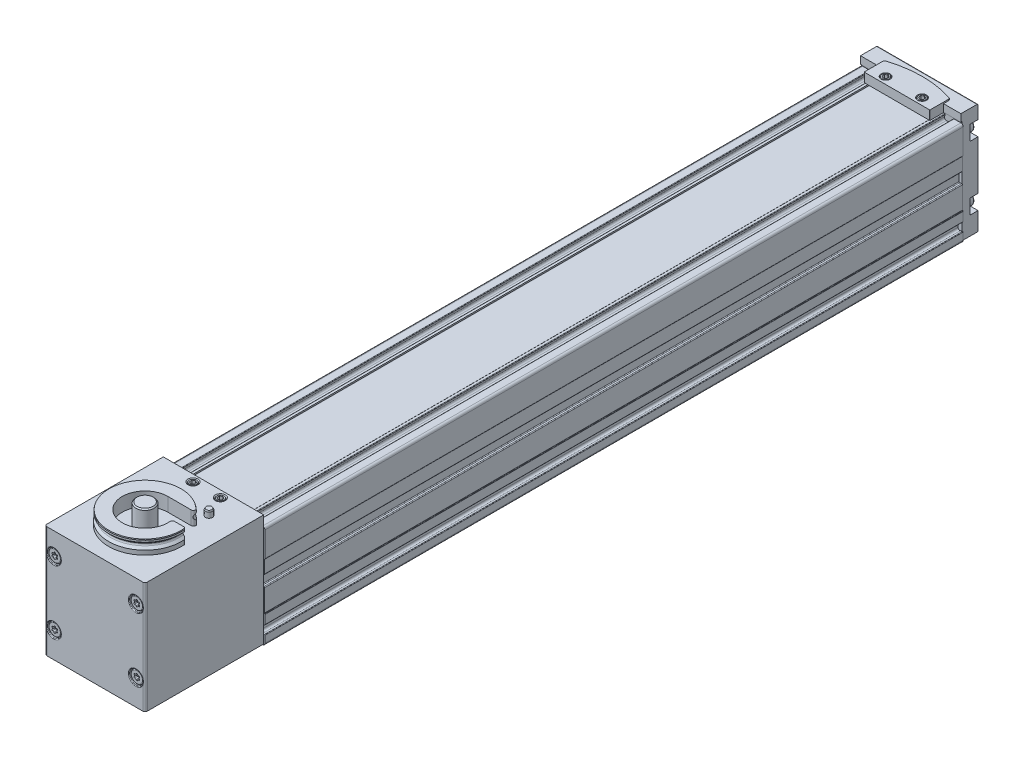
from build123d import *

# Parameters (mm, degrees)
BOSS_EXTRUDE1_DEPTH      = 49
BOSS_EXTRUDE2_DEPTH      = 306
SKETCH3_W                = 65
SKETCH3_H                = 55
CUT_EXTRUDE1_DEPTH       = 306
SKETCH4_W                = 65
SKETCH4_H                = 55
CUT_EXTRUDE2_DEPTH       = 266.5
SKETCH5_W                = 26
SKETCH5_H                = 0.1
BOSS_EXTRUDE3_DEPTH      = 306
BOSS_EXTRUDE4_DEPTH      = 6
LPATTERN1_COUNT          = 2
LPATTERN1_PITCH          = 28
LPATTERN2_COUNT          = 2
LPATTERN2_PITCH          = 28
CUT_EXTRUDE3_DEPTH       = 1.67
LPATTERN3_COUNT          = 2
LPATTERN3_PITCH          = 36
LPATTERN3_COUNT_DIR2     = 2
LPATTERN3_PITCH_DIR2     = 28
BOSS_EXTRUDE5_DEPTH      = 22
BOSS_EXTRUDE5_DEPTH_BACK = 22
BOSS_EXTRUDE6_DEPTH      = 4
CUT_EXTRUDE4_DEPTH       = 3.4
LPATTERN4_COUNT          = 2
LPATTERN4_PITCH          = 28
CUT_EXTRUDE5_DEPTH       = 3.4
LPATTERN5_COUNT          = 2
LPATTERN5_PITCH          = 28
LPATTERN6_COUNT          = 2
LPATTERN6_PITCH          = 28
LPATTERN7_COUNT          = 2
LPATTERN7_PITCH          = 28
CUT_EXTRUDE6_START       = 1.67
CUT_EXTRUDE6_DEPTH       = 1.67
LPATTERN8_COUNT          = 2
LPATTERN8_PITCH          = 36
LPATTERN8_COUNT_DIR2     = 2
LPATTERN8_PITCH_DIR2     = 28
CUT_EXTRUDE7_DEPTH       = 2.43
LPATTERN9_COUNT          = 2
LPATTERN9_PITCH          = 12
CUT_EXTRUDE8_DEPTH       = 2.1
LPATTERN10_COUNT         = 2
LPATTERN10_PITCH         = 12
LPATTERN11_COUNT         = 2
LPATTERN11_PITCH         = 16
LPATTERN12_COUNT         = 2
LPATTERN12_PITCH         = 16
CUT_EXTRUDE9_DEPTH       = 2.84
LPATTERN13_COUNT         = 2
LPATTERN13_PITCH         = 16
CUT_EXTRUDE10_DEPTH      = 2.5
LPATTERN14_COUNT         = 2
LPATTERN14_PITCH         = 32.984845005


with BuildPart() as part:
    # Sketch1 → Boss-Extrude1 (new body)
    with BuildSketch(Plane(origin=(0, 0, 0), x_dir=(1, 0, 0), z_dir=(0, 1, 0))):
        with BuildLine():
            Line((-21, -52), (21, -52))
            ThreePointArc((21, -52), (21.707106781, -51.707106781), (22, -51))
            Line((22, -51), (22, 0))
            Line((22, 0), (-22, 0))
            Line((-22, 0), (-22, -51))
            ThreePointArc((-22, -51), (-21.707106781, -51.707106781), (-21, -52))
        make_face()
    extrude(amount=BOSS_EXTRUDE1_DEPTH)

    # Sketch2 → Boss-Extrude2 (add)
    with BuildSketch(Plane.XY):
        Polygon((-22.5, -0.5), (22.5, -0.5), (22.5, 44.5), (13.4, 44.5), (13.4, 43.9), (-13.4, 43.9), (-13.4, 44.5), (-22.5, 44.5), align=None)
    extrude(amount=-BOSS_EXTRUDE2_DEPTH)

    # Sketch3 → Cut-Extrude1 (cut)
    with BuildSketch(Plane.XY):
        with Locations((0, 22)):
            Rectangle(SKETCH3_W, SKETCH3_H)
        with BuildLine():
            Line((-21.5, -0.5), (-18.460645075, -0.5))
            ThreePointArc((-18.460645075, -0.5), (-18.301974407, -0.421752286), (-18.267459909, -0.248236191))
            Line((-18.267459909, -0.248236191), (-18.546443505, 0.792944764))
            ThreePointArc((-18.546443505, 0.792944764), (-18.408385517, 1.487009143), (-17.773702844, 1.8))
            Line((-17.773702844, 1.8), (-15.126297156, 1.8))
            ThreePointArc((-15.126297156, 1.8), (-14.491614483, 1.487009143), (-14.353556495, 0.792944764))
            Line((-14.353556495, 0.792944764), (-14.632540091, -0.248236191))
            ThreePointArc((-14.632540091, -0.248236191), (-14.598025593, -0.421752286), (-14.439354925, -0.5))
            Line((-14.439354925, -0.5), (-7.582842712, -0.5))
            ThreePointArc((-7.582842712, -0.5), (-7.506306026, -0.484775907), (-7.441421356, -0.441421356))
            Line((-7.441421356, -0.441421356), (-7.308578644, -0.308578644))
            ThreePointArc((-7.308578644, -0.308578644), (-7.243693974, -0.265224093), (-7.167157288, -0.25))
            Line((-7.167157288, -0.25), (-4.832842712, -0.25))
            ThreePointArc((-4.832842712, -0.25), (-4.756306026, -0.265224093), (-4.691421356, -0.308578644))
            Line((-4.691421356, -0.308578644), (-4.558578644, -0.441421356))
            ThreePointArc((-4.558578644, -0.441421356), (-4.493693974, -0.484775907), (-4.417157288, -0.5))
            Line((-4.417157288, -0.5), (4.417157288, -0.5))
            ThreePointArc((4.417157288, -0.5), (4.493693974, -0.484775907), (4.558578644, -0.441421356))
            Line((4.558578644, -0.441421356), (4.691421356, -0.308578644))
            ThreePointArc((4.691421356, -0.308578644), (4.756306026, -0.265224093), (4.832842712, -0.25))
            Line((4.832842712, -0.25), (7.167157288, -0.25))
            ThreePointArc((7.167157288, -0.25), (7.243693974, -0.265224093), (7.308578644, -0.308578644))
            Line((7.308578644, -0.308578644), (7.441421356, -0.441421356))
            ThreePointArc((7.441421356, -0.441421356), (7.506306026, -0.484775907), (7.582842712, -0.5))
            Line((7.582842712, -0.5), (14.439354925, -0.5))
            ThreePointArc((14.439354925, -0.5), (14.598025593, -0.421752286), (14.632540091, -0.248236191))
            Line((14.632540091, -0.248236191), (14.353556495, 0.792944764))
            ThreePointArc((14.353556495, 0.792944764), (14.491614483, 1.487009143), (15.126297156, 1.8))
            Line((15.126297156, 1.8), (17.773702844, 1.8))
            ThreePointArc((17.773702844, 1.8), (18.408385517, 1.487009143), (18.546443505, 0.792944764))
            Line((18.546443505, 0.792944764), (18.267459909, -0.248236191))
            ThreePointArc((18.267459909, -0.248236191), (18.301974407, -0.421752286), (18.460645075, -0.5))
            Line((18.460645075, -0.5), (21.5, -0.5))
            ThreePointArc((21.5, -0.5), (22.207106781, -0.207106781), (22.5, 0.5))
            Line((22.5, 0.5), (22.5, 3.539354925))
            ThreePointArc((22.5, 3.539354925), (22.421752286, 3.698025593), (22.248236191, 3.732540091))
            Line((22.248236191, 3.732540091), (21.207055236, 3.453556495))
            ThreePointArc((21.207055236, 3.453556495), (20.512990857, 3.591614483), (20.2, 4.226297156))
            Line((20.2, 4.226297156), (20.2, 6.873702844))
            ThreePointArc((20.2, 6.873702844), (20.512990857, 7.508385517), (21.207055236, 7.646443505))
            Line((21.207055236, 7.646443505), (22.248236191, 7.367459909))
            ThreePointArc((22.248236191, 7.367459909), (22.421752286, 7.401974407), (22.5, 7.560645075))
            Line((22.5, 7.560645075), (22.5, 11.417157288))
            ThreePointArc((22.5, 11.417157288), (22.484775907, 11.493693974), (22.441421356, 11.558578644))
            Line((22.441421356, 11.558578644), (22.308578644, 11.691421356))
            ThreePointArc((22.308578644, 11.691421356), (22.265224093, 11.756306026), (22.25, 11.832842712))
            Line((22.25, 11.832842712), (22.25, 21.392473922))
            ThreePointArc((22.25, 21.392473922), (22.142836283, 21.622287255), (21.897905547, 21.687916248))
            Line((21.897905547, 21.687916248), (21.002094453, 21.529960583))
            ThreePointArc((21.002094453, 21.529960583), (20.757163717, 21.595589576), (20.65, 21.825402909))
            Line((20.65, 21.825402909), (20.65, 26.174597091))
            ThreePointArc((20.65, 26.174597091), (20.757163717, 26.404410424), (21.002094453, 26.470039417))
            Line((21.002094453, 26.470039417), (21.897905547, 26.312083752))
            ThreePointArc((21.897905547, 26.312083752), (22.142836283, 26.377712745), (22.25, 26.607526078))
            Line((22.25, 26.607526078), (22.25, 32.167157288))
            ThreePointArc((22.25, 32.167157288), (22.265224093, 32.243693974), (22.308578644, 32.308578644))
            Line((22.308578644, 32.308578644), (22.441421356, 32.441421356))
            ThreePointArc((22.441421356, 32.441421356), (22.484775907, 32.506306026), (22.5, 32.582842712))
            Line((22.5, 32.582842712), (22.5, 43.5))
            ThreePointArc((22.5, 43.5), (22.207106781, 44.207106781), (21.5, 44.5))
            Line((21.5, 44.5), (18.460645075, 44.5))
            ThreePointArc((18.460645075, 44.5), (18.301974407, 44.421752286), (18.267459909, 44.248236191))
            Line((18.267459909, 44.248236191), (18.546443505, 43.207055236))
            ThreePointArc((18.546443505, 43.207055236), (18.408385517, 42.512990857), (17.773702844, 42.2))
            Line((17.773702844, 42.2), (15.126297156, 42.2))
            ThreePointArc((15.126297156, 42.2), (14.491614483, 42.512990857), (14.353556495, 43.207055236))
            Line((14.353556495, 43.207055236), (14.632540091, 44.248236191))
            ThreePointArc((14.632540091, 44.248236191), (14.598025593, 44.421752286), (14.439354925, 44.5))
            Line((14.439354925, 44.5), (-14.439354925, 44.5))
            ThreePointArc((-14.439354925, 44.5), (-14.598025593, 44.421752286), (-14.632540091, 44.248236191))
            Line((-14.632540091, 44.248236191), (-14.353556495, 43.207055236))
            ThreePointArc((-14.353556495, 43.207055236), (-14.491614483, 42.512990857), (-15.126297156, 42.2))
            Line((-15.126297156, 42.2), (-17.773702844, 42.2))
            ThreePointArc((-17.773702844, 42.2), (-18.408385517, 42.512990857), (-18.546443505, 43.207055236))
            Line((-18.546443505, 43.207055236), (-18.267459909, 44.248236191))
            ThreePointArc((-18.267459909, 44.248236191), (-18.301974407, 44.421752286), (-18.460645075, 44.5))
            Line((-18.460645075, 44.5), (-21.5, 44.5))
            ThreePointArc((-21.5, 44.5), (-22.207106781, 44.207106781), (-22.5, 43.5))
            Line((-22.5, 43.5), (-22.5, 32.582842712))
            ThreePointArc((-22.5, 32.582842712), (-22.484775907, 32.506306026), (-22.441421356, 32.441421356))
            Line((-22.441421356, 32.441421356), (-22.308578644, 32.308578644))
            ThreePointArc((-22.308578644, 32.308578644), (-22.265224093, 32.243693974), (-22.25, 32.167157288))
            Line((-22.25, 32.167157288), (-22.25, 26.607526078))
            ThreePointArc((-22.25, 26.607526078), (-22.142836283, 26.377712745), (-21.897905547, 26.312083752))
            Line((-21.897905547, 26.312083752), (-21.002094453, 26.470039417))
            ThreePointArc((-21.002094453, 26.470039417), (-20.757163717, 26.404410424), (-20.65, 26.174597091))
            Line((-20.65, 26.174597091), (-20.65, 21.825402909))
            ThreePointArc((-20.65, 21.825402909), (-20.757163717, 21.595589576), (-21.002094453, 21.529960583))
            Line((-21.002094453, 21.529960583), (-21.897905547, 21.687916248))
            ThreePointArc((-21.897905547, 21.687916248), (-22.142836283, 21.622287255), (-22.25, 21.392473922))
            Line((-22.25, 21.392473922), (-22.25, 11.832842712))
            ThreePointArc((-22.25, 11.832842712), (-22.265224093, 11.756306026), (-22.308578644, 11.691421356))
            Line((-22.308578644, 11.691421356), (-22.441421356, 11.558578644))
            ThreePointArc((-22.441421356, 11.558578644), (-22.484775907, 11.493693974), (-22.5, 11.417157288))
            Line((-22.5, 11.417157288), (-22.5, 7.560645075))
            ThreePointArc((-22.5, 7.560645075), (-22.421752286, 7.401974407), (-22.248236191, 7.367459909))
            Line((-22.248236191, 7.367459909), (-21.207055236, 7.646443505))
            ThreePointArc((-21.207055236, 7.646443505), (-20.512990857, 7.508385517), (-20.2, 6.873702844))
            Line((-20.2, 6.873702844), (-20.2, 4.226297156))
            ThreePointArc((-20.2, 4.226297156), (-20.512990857, 3.591614483), (-21.207055236, 3.453556495))
            Line((-21.207055236, 3.453556495), (-22.248236191, 3.732540091))
            ThreePointArc((-22.248236191, 3.732540091), (-22.421752286, 3.698025593), (-22.5, 3.539354925))
            Line((-22.5, 3.539354925), (-22.5, 0.5))
            ThreePointArc((-22.5, 0.5), (-22.207106781, -0.207106781), (-21.5, -0.5))
        make_face(mode=Mode.SUBTRACT)
    extrude(amount=-CUT_EXTRUDE1_DEPTH, mode=Mode.SUBTRACT)

    # Sketch4 → Cut-Extrude2 (cut)
    with BuildSketch(Plane.XY.offset(-271.25)):
        with Locations((0, 22)):
            Rectangle(SKETCH4_W, SKETCH4_H)
        Polygon((-22.5, -0.5), (22.5, -0.5), (22.5, 44.5), (13.4, 44.5), (13.4, 43.9), (10, 43.9), (10, 28), (17, 28), (17, 21.5), (-17, 21.5), (-17, 28), (-10, 28), (-10, 43.9), (-13.4, 43.9), (-13.4, 44.5), (-22.5, 44.5), align=None, mode=Mode.SUBTRACT)
    extrude(amount=CUT_EXTRUDE2_DEPTH, mode=Mode.SUBTRACT)

    # Sketch5 → Boss-Extrude3 (add)
    with BuildSketch(Plane.XY):
        with Locations((0, 44.11)):
            Rectangle(SKETCH5_W, SKETCH5_H)
    extrude(amount=-BOSS_EXTRUDE3_DEPTH)

    # Sketch6 → Boss-Extrude4 (add)
    with BuildSketch(Plane(origin=(0, 49, 0), x_dir=(1, 0, 0), z_dir=(0, 1, 0))):
        with BuildLine():
            Line((14.966629547, -28), (10.95445115, -28))
            ThreePointArc((10.95445115, -28), (10.215902204, -28.325800138), (9.958591955, -29.090909091))
            ThreePointArc((9.958591955, -29.090909091), (-6.741998625, -37.385489459), (0, -20))
            Line((0, -20), (10.198039027, -20))
            ThreePointArc((10.198039027, -20), (11.128988363, -19.365148372), (10.877908296, -18.266666667))
            ThreePointArc((10.877908296, -18.266666667), (-14.442018148, -36.886807083), (15.96440485, -28.933333333))
            ThreePointArc((15.96440485, -28.933333333), (15.649759598, -28.269703257), (14.966629547, -28))
        make_face()
    extrude(amount=BOSS_EXTRUDE4_DEPTH)

    # Sketch7 → Cut-Revolve1 (revolve, cut)
    with BuildSketch(Plane(origin=(0, 0, 0), x_dir=(0, 0, -1), z_dir=(1, 0, 0))):
        with BuildLine():
            Line((-14.97372583, 51.869669914), (-14, 50.895944084))
            Line((-14, 50.895944084), (-14, 49))
            Line((-14, 49), (-4, 49))
            Line((-4, 49), (-4, 55))
            Line((-4, 55), (-14.207179677, 55))
            Line((-14.207179677, 55), (-14.1, 54.6))
            Line((-14.1, 54.6), (-14.1, 53.804055916))
            Line((-14.1, 53.804055916), (-14.97372583, 52.930330086))
            ThreePointArc((-14.97372583, 52.930330086), (-15.193395744, 52.4), (-14.97372583, 51.869669914))
        make_face()
    revolve(axis=Axis((0, 49, 30), (0, 1, 0)), mode=Mode.SUBTRACT)

    # Sketch8 → Revolve1 (revolve)
    with BuildSketch(Plane.XY.offset(30)):
        Polygon((0, 58), (3.5, 58), (4, 57.5), (4, 49), (0, 49), align=None)
    revolve(axis=Axis((0, 49, 30), (0, 1, 0)))

    # Sketch9 → Cut-Revolve2 (revolve, cut)
    with BuildSketch(Plane(origin=(-18, 0, 0), x_dir=(0, 0, -1), z_dir=(1, 0, 0))):
        with BuildLine():
            Line((-52, 39.25), (-52, 42.6))
            ThreePointArc((-52, 42.6), (-51.912132034, 42.387867966), (-51.7, 42.3))
            Line((-51.7, 42.3), (-48.8, 42.3))
            Line((-48.8, 42.3), (-48.8, 42))
            Line((-48.8, 42), (-51.3, 42))
            ThreePointArc((-51.3, 42), (-51.512132034, 41.912132034), (-51.6, 41.7))
            Line((-51.6, 41.7), (-51.6, 39.25))
            Line((-51.6, 39.25), (-52, 39.25))
        make_face()
    cut_revolve2 = revolve(axis=Axis((-18, 39.25, 51.6), (0, 0, 1)), mode=Mode.SUBTRACT)

    # LPattern1: Cut-Revolve2 ×2
    with Locations(*[(0, -i * LPATTERN1_PITCH, 0) for i in range(1, LPATTERN1_COUNT)]):
        add(cut_revolve2, mode=Mode.SUBTRACT)

    # Sketch11 → Cut-Revolve3 (revolve, cut)
    with BuildSketch(Plane(origin=(18, 0, 0), x_dir=(0, 0, -1), z_dir=(1, 0, 0))):
        with BuildLine():
            Line((-52, 39.25), (-52, 42.6))
            ThreePointArc((-52, 42.6), (-51.912132034, 42.387867966), (-51.7, 42.3))
            Line((-51.7, 42.3), (-48.8, 42.3))
            Line((-48.8, 42.3), (-48.8, 42))
            Line((-48.8, 42), (-51.3, 42))
            ThreePointArc((-51.3, 42), (-51.512132034, 41.912132034), (-51.6, 41.7))
            Line((-51.6, 41.7), (-51.6, 39.25))
            Line((-51.6, 39.25), (-52, 39.25))
        make_face()
    cut_revolve3 = revolve(axis=Axis((18, 39.25, 51.6), (0, 0, 1)), mode=Mode.SUBTRACT)

    # LPattern2: Cut-Revolve3 ×2
    with Locations(*[(0, -i * LPATTERN2_PITCH, 0) for i in range(1, LPATTERN2_COUNT)]):
        add(cut_revolve3, mode=Mode.SUBTRACT)

    # Sketch13 → Cut-Extrude3 (cut)
    with BuildSketch(Plane.XY.offset(52)):
        with BuildLine():
            ThreePointArc((-19.162126056, 38.893636364), (-19.212435565, 38.55), (-18.88968299, 38.421751131))
            ThreePointArc((-18.88968299, 38.421751131), (-18.504218431, 38.376668059), (-18.272443066, 38.065387495))
            ThreePointArc((-18.272443066, 38.065387495), (-18, 37.85), (-17.727556934, 38.065387495))
            ThreePointArc((-17.727556934, 38.065387495), (-17.495781569, 38.376668059), (-17.11031701, 38.421751131))
            ThreePointArc((-17.11031701, 38.421751131), (-16.787564435, 38.55), (-16.837873944, 38.893636364))
            ThreePointArc((-16.837873944, 38.893636364), (-16.991563137, 39.25), (-16.837873944, 39.606363636))
            ThreePointArc((-16.837873944, 39.606363636), (-16.787564435, 39.95), (-17.11031701, 40.078248869))
            ThreePointArc((-17.11031701, 40.078248869), (-17.495781569, 40.123331941), (-17.727556934, 40.434612505))
            ThreePointArc((-17.727556934, 40.434612505), (-18, 40.65), (-18.272443066, 40.434612505))
            ThreePointArc((-18.272443066, 40.434612505), (-18.504218431, 40.123331941), (-18.88968299, 40.078248869))
            ThreePointArc((-18.88968299, 40.078248869), (-19.212435565, 39.95), (-19.162126056, 39.606363636))
            ThreePointArc((-19.162126056, 39.606363636), (-19.008436863, 39.25), (-19.162126056, 38.893636364))
        make_face()
    cut_extrude3 = extrude(amount=-CUT_EXTRUDE3_DEPTH, mode=Mode.SUBTRACT)

    # LPattern3: Cut-Extrude3 2 × 2
    with Locations(*[(i * LPATTERN3_PITCH, -j * LPATTERN3_PITCH_DIR2, 0) for i in range(LPATTERN3_COUNT) for j in range(LPATTERN3_COUNT_DIR2) if (i, j) != (0, 0)]):
        add(cut_extrude3, mode=Mode.SUBTRACT)

    # Sketch15 → Boss-Extrude5 (add, two sides: drawn at the far end of the back side and taken through both)
    with BuildSketch(Plane(origin=(0, 0, 0), x_dir=(0, 0, -1), z_dir=(1, 0, 0)).offset(-BOSS_EXTRUDE5_DEPTH_BACK)):
        with BuildLine():
            Line((305.5, 45.25), (306, 45.25))
            Line((306, 45.25), (306, 0))
            Line((306, 0), (312.55, 0))
            ThreePointArc((312.55, 0), (312.868198052, 0.131801948), (313, 0.45))
            Line((313, 0.45), (313, 48.05))
            ThreePointArc((313, 48.05), (312.868198052, 48.368198052), (312.55, 48.5))
            Line((312.55, 48.5), (305.5, 48.5))
            Line((305.5, 48.5), (305.5, 45.25))
        make_face()
    extrude(amount=BOSS_EXTRUDE5_DEPTH + BOSS_EXTRUDE5_DEPTH_BACK)

    # Sketch16 → Boss-Extrude6 (add)
    with BuildSketch(Plane(origin=(0, 49.1, 0), x_dir=(1, 0, 0), z_dir=(0, 1, 0))):
        with BuildLine():
            Line((-14.2, 299.5), (14.2, 299.5))
            ThreePointArc((14.2, 299.5), (14.341421356, 299.558578644), (14.4, 299.7))
            Line((14.4, 299.7), (14.4, 307.692042003))
            ThreePointArc((14.4, 307.692042003), (14.25663702, 308.133053937), (13.881355932, 308.405466444))
            ThreePointArc((13.881355932, 308.405466444), (0, 310.6), (-13.881355932, 308.405466444))
            ThreePointArc((-13.881355932, 308.405466444), (-14.25663702, 308.133053937), (-14.4, 307.692042003))
            Line((-14.4, 307.692042003), (-14.4, 299.7))
            ThreePointArc((-14.4, 299.7), (-14.341421356, 299.558578644), (-14.2, 299.5))
        make_face()
    extrude(amount=-BOSS_EXTRUDE6_DEPTH)

    # Sketch17 → Cut-Extrude4 (cut)
    with BuildSketch(Plane.XY.offset(-313)):
        with BuildLine():
            Line((18, 36), (22, 36))
            Line((22, 36), (22, 42.5))
            Line((22, 42.5), (18, 42.5))
            ThreePointArc((18, 42.5), (14.75, 39.25), (18, 36))
        make_face()
    cut_extrude4 = extrude(amount=CUT_EXTRUDE4_DEPTH, mode=Mode.SUBTRACT)

    # LPattern4: Cut-Extrude4 ×2
    with Locations(*[(0, -i * LPATTERN4_PITCH, 0) for i in range(1, LPATTERN4_COUNT)]):
        add(cut_extrude4, mode=Mode.SUBTRACT)

    # Sketch19 → Cut-Extrude5 (cut)
    with BuildSketch(Plane.XY.offset(-313)):
        with BuildLine():
            Line((-22, 36), (-18, 36))
            ThreePointArc((-18, 36), (-14.75, 39.25), (-18, 42.5))
            Line((-18, 42.5), (-22, 42.5))
            Line((-22, 42.5), (-22, 36))
        make_face()
    cut_extrude5 = extrude(amount=CUT_EXTRUDE5_DEPTH, mode=Mode.SUBTRACT)

    # LPattern5: Cut-Extrude5 ×2
    with Locations(*[(0, -i * LPATTERN5_PITCH, 0) for i in range(1, LPATTERN5_COUNT)]):
        add(cut_extrude5, mode=Mode.SUBTRACT)

    # Sketch21 → Revolve2 (revolve)
    with BuildSketch(Plane(origin=(18, 0, 0), x_dir=(0, 0, -1), z_dir=(1, 0, 0))):
        with BuildLine():
            Line((309.6, 39.25), (309.6, 42))
            Line((309.6, 42), (312.3, 42))
            ThreePointArc((312.3, 42), (312.512132034, 41.912132034), (312.6, 41.7))
            Line((312.6, 41.7), (312.6, 39.25))
            Line((312.6, 39.25), (309.6, 39.25))
        make_face()
    revolve2 = revolve(axis=Axis((18, 39.25, -312.6), (0, 0, 1)))

    # LPattern6: Revolve2 ×2
    with Locations(*[(0, -i * LPATTERN6_PITCH, 0) for i in range(1, LPATTERN6_COUNT)]):
        add(revolve2)

    # Sketch23 → Revolve3 (revolve)
    with BuildSketch(Plane(origin=(-18, 0, 0), x_dir=(0, 0, -1), z_dir=(1, 0, 0))):
        with BuildLine():
            Line((309.6, 39.25), (309.6, 42))
            Line((309.6, 42), (312.3, 42))
            ThreePointArc((312.3, 42), (312.512132034, 41.912132034), (312.6, 41.7))
            Line((312.6, 41.7), (312.6, 39.25))
            Line((312.6, 39.25), (309.6, 39.25))
        make_face()
    revolve3 = revolve(axis=Axis((-18, 39.25, -312.6), (0, 0, 1)))

    # LPattern7: Revolve3 ×2
    with Locations(*[(0, -i * LPATTERN7_PITCH, 0) for i in range(1, LPATTERN7_COUNT)]):
        add(revolve3)

    # Sketch25 → Cut-Extrude6 (cut)
    with BuildSketch(Plane.XY.offset(-313).offset(CUT_EXTRUDE6_START)):
        with BuildLine():
            ThreePointArc((-19.162126056, 38.893636364), (-19.212435565, 38.55), (-18.88968299, 38.421751131))
            ThreePointArc((-18.88968299, 38.421751131), (-18.504218431, 38.376668059), (-18.272443066, 38.065387495))
            ThreePointArc((-18.272443066, 38.065387495), (-18, 37.85), (-17.727556934, 38.065387495))
            ThreePointArc((-17.727556934, 38.065387495), (-17.495781569, 38.376668059), (-17.11031701, 38.421751131))
            ThreePointArc((-17.11031701, 38.421751131), (-16.787564435, 38.55), (-16.837873944, 38.893636364))
            ThreePointArc((-16.837873944, 38.893636364), (-16.991563137, 39.25), (-16.837873944, 39.606363636))
            ThreePointArc((-16.837873944, 39.606363636), (-16.787564435, 39.95), (-17.11031701, 40.078248869))
            ThreePointArc((-17.11031701, 40.078248869), (-17.495781569, 40.123331941), (-17.727556934, 40.434612505))
            ThreePointArc((-17.727556934, 40.434612505), (-18, 40.65), (-18.272443066, 40.434612505))
            ThreePointArc((-18.272443066, 40.434612505), (-18.504218431, 40.123331941), (-18.88968299, 40.078248869))
            ThreePointArc((-18.88968299, 40.078248869), (-19.212435565, 39.95), (-19.162126056, 39.606363636))
            ThreePointArc((-19.162126056, 39.606363636), (-19.008436863, 39.25), (-19.162126056, 38.893636364))
        make_face()
    cut_extrude6 = extrude(amount=-CUT_EXTRUDE6_DEPTH, mode=Mode.SUBTRACT)

    # LPattern8: Cut-Extrude6 2 × 2
    with Locations(*[(i * LPATTERN8_PITCH, -j * LPATTERN8_PITCH_DIR2, 0) for i in range(LPATTERN8_COUNT) for j in range(LPATTERN8_COUNT_DIR2) if (i, j) != (0, 0)]):
        add(cut_extrude6, mode=Mode.SUBTRACT)

    # Sketch27 → Cut-Revolve4 (revolve, cut)
    with BuildSketch(Plane(origin=(0, 0, 0), x_dir=(0, 0, -1), z_dir=(1, 0, 0))):
        with BuildLine():
            Line((312.6, 31.5), (312.6, 35.25))
            ThreePointArc((312.6, 35.25), (312.453553391, 35.603553391), (312.1, 35.75))
            Line((312.1, 35.75), (307.6, 35.75))
            Line((307.6, 35.75), (307.6, 36.5))
            Line((307.6, 36.5), (313, 36.5))
            Line((313, 36.5), (313, 31.5))
            Line((313, 31.5), (312.6, 31.5))
        make_face()
    revolve(axis=Axis((0, 31.5, -313), (0, 0, 1)), mode=Mode.SUBTRACT)

    # Sketch28 → Cut-Extrude7 (cut)
    with BuildSketch(Plane.XY.offset(-313)):
        with BuildLine():
            ThreePointArc((-1.866664978, 30.927590909), (-1.947474627, 30.375625), (-1.429053303, 30.169625255))
            ThreePointArc((-1.429053303, 30.169625255), (-0.809900855, 30.097210569), (-0.437611675, 29.597216164))
            ThreePointArc((-0.437611675, 29.597216164), (0, 29.25125), (0.437611675, 29.597216164))
            ThreePointArc((0.437611675, 29.597216164), (0.809900855, 30.097210569), (1.429053303, 30.169625255))
            ThreePointArc((1.429053303, 30.169625255), (1.947474627, 30.375625), (1.866664978, 30.927590909))
            ThreePointArc((1.866664978, 30.927590909), (1.619801711, 31.5), (1.866664978, 32.072409091))
            ThreePointArc((1.866664978, 32.072409091), (1.947474627, 32.624375), (1.429053303, 32.830374745))
            ThreePointArc((1.429053303, 32.830374745), (0.809900855, 32.902789431), (0.437611675, 33.402783836))
            ThreePointArc((0.437611675, 33.402783836), (0, 33.74875), (-0.437611675, 33.402783836))
            ThreePointArc((-0.437611675, 33.402783836), (-0.809900855, 32.902789431), (-1.429053303, 32.830374745))
            ThreePointArc((-1.429053303, 32.830374745), (-1.947474627, 32.624375), (-1.866664978, 32.072409091))
            ThreePointArc((-1.866664978, 32.072409091), (-1.619801711, 31.5), (-1.866664978, 30.927590909))
        make_face()
    extrude(amount=CUT_EXTRUDE7_DEPTH, mode=Mode.SUBTRACT)

    # Sketch29 → Cut-Revolve5 (revolve, cut)
    with BuildSketch(Plane(origin=(0, 0, 0), x_dir=(0, 0, -1), z_dir=(1, 0, 0))):
        Polygon((313, 12), (313, 7.136), (312.419, 7.717), (304.1, 7.717), (304.1, 12), align=None)
    revolve(axis=Axis((0, 12, -304.1), (0, 0, -1)), mode=Mode.SUBTRACT)

    # Sketch30 → Cut-Revolve6 (revolve, cut)
    with BuildSketch(Plane.XY.offset(3)):
        Polygon((6, 49), (8.2, 49), (7.75, 48.7), (7.57, 48.9), (6, 48.9), align=None)
    cut_revolve6 = revolve(axis=Axis((6, 48.9, 3), (0, 1, 0)), mode=Mode.SUBTRACT)

    # LPattern9: Cut-Revolve6 ×2
    with Locations(*[(-i * LPATTERN9_PITCH, 0, 0) for i in range(1, LPATTERN9_COUNT)]):
        add(cut_revolve6, mode=Mode.SUBTRACT)

    # Sketch32 → Cut-Extrude8 (cut)
    with BuildSketch(Plane(origin=(0, 47.2, 0), x_dir=(1, 0, 0), z_dir=(0, 1, 0))):
        Polygon((5, -3.577350269), (6, -4.154700538), (7, -3.577350269), (7, -2.422649731), (6, -1.845299462), (5, -2.422649731), align=None)
    cut_extrude8 = extrude(amount=CUT_EXTRUDE8_DEPTH, mode=Mode.SUBTRACT)

    # LPattern10: Cut-Extrude8 ×2
    with Locations(*[(-i * LPATTERN10_PITCH, 0, 0) for i in range(1, LPATTERN10_COUNT)]):
        add(cut_extrude8, mode=Mode.SUBTRACT)

    # Sketch34 → Cut-Revolve7 (revolve, cut)
    with BuildSketch(Plane.XY.offset(-302.5)):
        Polygon((8, 49.1), (10, 49.1), (9.621, 48.721), (9.621, 45.1), (8, 45.1), align=None)
    cut_revolve7 = revolve(axis=Axis((8, 45.1, -302.5), (0, 1, 0)), mode=Mode.SUBTRACT)

    # LPattern11: Cut-Revolve7 ×2
    with Locations(*[(-i * LPATTERN11_PITCH, 0, 0) for i in range(1, LPATTERN11_COUNT)]):
        add(cut_revolve7, mode=Mode.SUBTRACT)

    # Sketch36 → Revolve4 (revolve)
    with BuildSketch(Plane.XY.offset(-302.5)):
        Polygon((8, 49.1), (9.5705, 49.1), (10, 48.6705), (10, 44.5), (9.6, 44.1), (8, 44.1), align=None)
    revolve4 = revolve(axis=Axis((8, 44.1, -302.5), (0, 1, 0)))

    # LPattern12: Revolve4 ×2
    with Locations(*[(-i * LPATTERN12_PITCH, 0, 0) for i in range(1, LPATTERN12_COUNT)]):
        add(revolve4)

    # Sketch38 → Cut-Extrude9 (cut, symmetric)
    with BuildSketch(Plane(origin=(0, 49, 0), x_dir=(1, 0, 0), z_dir=(0, 1, 0))):
        Polygon((7, 301.922649731), (8, 301.345299462), (9, 301.922649731), (9, 303.077350269), (8, 303.654700538), (7, 303.077350269), align=None)
    cut_extrude9 = extrude(amount=CUT_EXTRUDE9_DEPTH, both=True, mode=Mode.SUBTRACT)

    # LPattern13: Cut-Extrude9 ×2
    with Locations(*[(-i * LPATTERN13_PITCH, 0, 0) for i in range(1, LPATTERN13_COUNT)]):
        add(cut_extrude9, mode=Mode.SUBTRACT)

    # Sketch40 → Cut-Revolve8 (revolve, cut)
    with BuildSketch(Plane(origin=(4, 0, 0), x_dir=(0, 0, -1), z_dir=(1, 0, 0))):
        with BuildLine():
            Line((-46, 1), (-42.9, 1))
            ThreePointArc((-42.9, 1), (-42.617157288, 1.117157288), (-42.5, 1.4))
            Line((-42.5, 1.4), (-42.5, 5))
            Line((-42.5, 5), (-41.95, 5))
            Line((-41.95, 5), (-41.95, 0.3))
            ThreePointArc((-41.95, 0.3), (-41.862132034, 0.087867966), (-41.65, 0))
            Line((-41.65, 0), (-46, 0))
            Line((-46, 0), (-46, 1))
        make_face()
    revolve(axis=Axis((4, 0, 46), (0, 1, 0)), mode=Mode.SUBTRACT)

    # Sketch41 → Cut-Revolve9 (revolve, cut)
    with BuildSketch(Plane(origin=(-4, 0, 0), x_dir=(0, 0, -1), z_dir=(1, 0, 0))):
        with BuildLine():
            Line((-14, 1), (-10.9, 1))
            ThreePointArc((-10.9, 1), (-10.617157288, 1.117157288), (-10.5, 1.4))
            Line((-10.5, 1.4), (-10.5, 5))
            Line((-10.5, 5), (-9.95, 5))
            Line((-9.95, 5), (-9.95, 0.3))
            ThreePointArc((-9.95, 0.3), (-9.862132034, 0.087867966), (-9.65, 0))
            Line((-9.65, 0), (-14, 0))
            Line((-14, 0), (-14, 1))
        make_face()
    revolve(axis=Axis((-4, 0, 14), (0, 1, 0)), mode=Mode.SUBTRACT)

    # Sketch42 → Cut-Extrude10 (cut)
    with BuildSketch(Plane(origin=(0, 0, 0), x_dir=(1, 0, 0), z_dir=(0, 1, 0))):
        with BuildLine():
            ThreePointArc((2.358496946, -46.503363636), (2.287434764, -46.98875), (2.743322776, -47.169901527))
            ThreePointArc((2.743322776, -47.169901527), (3.287791466, -47.233581367), (3.615174169, -47.673265163))
            ThreePointArc((3.615174169, -47.673265163), (4, -47.9775), (4.384825831, -47.673265163))
            ThreePointArc((4.384825831, -47.673265163), (4.712208534, -47.233581367), (5.256677224, -47.169901527))
            ThreePointArc((5.256677224, -47.169901527), (5.712565236, -46.98875), (5.641503054, -46.503363636))
            ThreePointArc((5.641503054, -46.503363636), (5.424417069, -46), (5.641503054, -45.496636364))
            ThreePointArc((5.641503054, -45.496636364), (5.712565236, -45.01125), (5.256677224, -44.830098473))
            ThreePointArc((5.256677224, -44.830098473), (4.712208534, -44.766418633), (4.384825831, -44.326734837))
            ThreePointArc((4.384825831, -44.326734837), (4, -44.0225), (3.615174169, -44.326734837))
            ThreePointArc((3.615174169, -44.326734837), (3.287791466, -44.766418633), (2.743322776, -44.830098473))
            ThreePointArc((2.743322776, -44.830098473), (2.287434764, -45.01125), (2.358496946, -45.496636364))
            ThreePointArc((2.358496946, -45.496636364), (2.575582931, -46), (2.358496946, -46.503363636))
        make_face()
    cut_extrude10 = extrude(amount=CUT_EXTRUDE10_DEPTH, mode=Mode.SUBTRACT)

    # LPattern14: Cut-Extrude10 ×2
    with Locations(*[Vector(-0.2425356250363334, 0, -0.9701425001453318) * (i * LPATTERN14_PITCH) for i in range(1, LPATTERN14_COUNT)]):
        add(cut_extrude10, mode=Mode.SUBTRACT)

    # Sketch44 → Revolve5 (revolve)
    with BuildSketch(Plane(origin=(12.990381057, 0, 7.5), x_dir=(0.4999999999999995, 0, -0.866025403784439), z_dir=(0.8660254037844389, 0, 0.49999999999999944))):
        Polygon((-5.480762114, 51.83), (-4.269437248, 51.83), (-3.980762114, 51.33), (-3.980762114, 49), (-5.480762114, 49), align=None)
    revolve(axis=Axis((10.25, 49, 12.246479222), (0, 1, 0)))


solid = part.part
